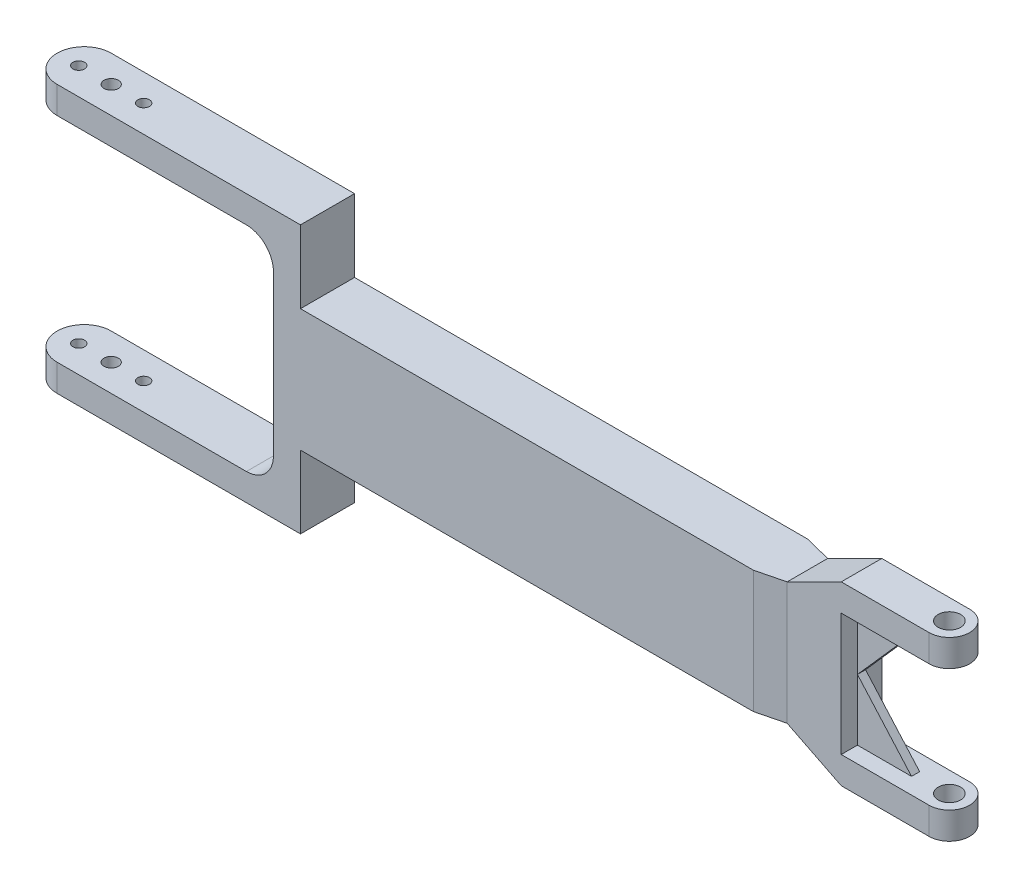
from build123d import *

# Parameters (mm, degrees)
SKETCH_2_W               = 187.5
SKETCH_2_H               = 45.3
EXTRUDE_1_DEPTH          = 10
EXTRUDE_2_DEPTH          = 7.5
CHAMFER_1_SIZE           = 20
CHAMFER_1_SIZE_2         = 5
CHAMFER_2_SIZE           = 5
CHAMFER_2_SIZE_2         = 20
SKETCH_7_W               = 40
SKETCH_7_H               = 10
EXTRUDE_6_DEPTH          = 15
SKETCH_7_3_W             = 40
SKETCH_7_3_H             = 10
CUT_EXTRUDE_3_DEPTH      = 15
EXTRUDE_7_DEPTH          = 1.5
CUT_EXTRUDE_1_DEPTH      = 314.699298692
CUT_EXTRUDE_2_DEPTH      = 307.287238552
CUT_EXTRUDE_2_DEPTH_BACK = 307.287238552
FILLET_1_R               = 10


with BuildPart() as part:
    # 草图2 → 凸台-拉伸1 (new, symmetric)
    with BuildSketch(Plane.XY):
        with Locations((-103.75, 0)):
            Rectangle(SKETCH_2_W, SKETCH_2_H)
        Polygon((-297.5, 49.5), (-297.5, 39.5), (-207.5, 39.5), (-207.5, -39.5), (-297.5, -39.5), (-297.5, -49.5), (-197.5, -49.5), (-197.5, 49.5), align=None)
    extrude(amount=EXTRUDE_1_DEPTH, both=True)

    # 草图2<3> → 凸台-拉伸2 (add, symmetric)
    with BuildSketch(Plane.XY):
        Polygon((40, -22.65), (40, -12.65), (0, -12.65), (0, 12.65), (40, 12.65), (40, 22.65), (-10, 22.65), (-10, -22.65), align=None)
    extrude(amount=EXTRUDE_2_DEPTH, both=True)

    # 倒角1
    # the kernel refuses this chamfer: 20, 5 mm, written as the material it takes off along each edge
    with BuildSketch(Plane(origin=(-10, -74.592549995, 10), x_dir=(-0.9999563942249224, 0, 0.00933861064031752), z_dir=(0, 1, 0))) as chamfer_1_piece_1_section:
        Polygon((CHAMFER_1_SIZE * 0.999956394225, -CHAMFER_1_SIZE * 0.00933861064032), (-CHAMFER_1_SIZE_2 * 0.00933861064032, -CHAMFER_1_SIZE_2 * 0.999956394225), (0, 0), align=None)
    chamfer_1_piece_1 = extrude(amount=149.185099991, mode=Mode.PRIVATE)
    chamfer_1_piece_1 = split(chamfer_1_piece_1, bisect_by=Plane(origin=(-18.245866107, 0, 7.5), z_dir=(0, 0, 1)), keep=Keep.TOP, mode=Mode.PRIVATE)
    add(chamfer_1_piece_1, mode=Mode.SUBTRACT)

    # 倒角2
    # the kernel refuses this chamfer: 20, 5 mm, written as the material it takes off along each edge
    with BuildSketch(Plane(origin=(-10, -74.592549995, -10), x_dir=(0.14778356633657133, 0, 0.9890197255468893), z_dir=(0, 1, 0))) as chamfer_2_piece_1_section:
        Polygon((CHAMFER_2_SIZE * 0.989019725547, -CHAMFER_2_SIZE * 0.147783566337), (-CHAMFER_2_SIZE_2 * 0.147783566337, -CHAMFER_2_SIZE_2 * 0.989019725547), (0, 0), align=None)
    chamfer_2_piece_1 = extrude(amount=149.185099991, mode=Mode.PRIVATE)
    chamfer_2_piece_1 = split(chamfer_2_piece_1, bisect_by=Plane(origin=(-18.245866107, 0, -7.5), z_dir=(0, 0, -1)), keep=Keep.TOP, mode=Mode.PRIVATE)
    add(chamfer_2_piece_1, mode=Mode.SUBTRACT)

    # 草图7 → 凸台-拉伸6 (add)
    with BuildSketch(Plane.XY.offset(7.5)):
        Polygon((0, 22.65), (0, 32.65), (-20, 22.65), align=None)
        with Locations((20, 27.65)):
            Rectangle(SKETCH_7_W, SKETCH_7_H)
        Polygon((40, -32.65), (0, -32.65), (-20, -22.65), (40, -22.65), align=None)
    extrude(amount=-EXTRUDE_6_DEPTH)

    # 草图7<3> → 切除-拉伸3 (cut)
    with BuildSketch(Plane.XY.offset(7.5)):
        with Locations((20, 17.65)):
            Rectangle(SKETCH_7_3_W, SKETCH_7_3_H)
        with Locations((20, -17.65)):
            Rectangle(SKETCH_7_3_W, SKETCH_7_3_H)
    extrude(amount=-CUT_EXTRUDE_3_DEPTH, mode=Mode.SUBTRACT)

    # 草图8 → 凸台-拉伸7 (add, symmetric)
    with BuildSketch(Plane.XY):
        Polygon((0, 22.65), (0, 0), (20, 22.65), align=None)
        Polygon((20, -22.65), (0, 0), (0, -22.65), align=None)
    extrude(amount=EXTRUDE_7_DEPTH, both=True)

    # 草图3 → 切除-拉伸1 (cut, through all)
    with BuildSketch(Plane(origin=(0, 49.5, 0), x_dir=(1, 0, 0), z_dir=(0, 1, 0))):
        with BuildLine():
            ThreePointArc((-297.5, 0), (-294.571067812, 7.071067812), (-287.5, 10))
            Line((-287.5, 10), (-297.5, 10))
            Line((-297.5, 10), (-297.5, 0))
        make_face()
        with BuildLine():
            Line((-297.5, -10), (-287.5, -10))
            ThreePointArc((-287.5, -10), (-294.571067812, -7.071067812), (-297.5, 0))
            Line((-297.5, 0), (-297.5, -10))
        make_face()
        with BuildLine():
            ThreePointArc((-291.65, 0), (-289.5, -2.15), (-287.35, 0))
            Line((-287.35, 0), (-291.65, 0))
        make_face()
        with BuildLine():
            Line((-291.65, 0), (-287.35, 0))
            ThreePointArc((-287.35, 0), (-289.5, 2.15), (-291.65, 0))
        make_face()
        with BuildLine():
            ThreePointArc((-280.15, 0), (-277.5, -2.65), (-274.85, 0))
            Line((-274.85, 0), (-280.15, 0))
        make_face()
        with BuildLine():
            Line((-280.15, 0), (-274.85, 0))
            ThreePointArc((-274.85, 0), (-277.5, 2.65), (-280.15, 0))
        make_face()
        with BuildLine():
            ThreePointArc((-267.65, 0), (-265.5, -2.15), (-263.35, 0))
            Line((-263.35, 0), (-267.65, 0))
        make_face()
        with BuildLine():
            Line((-267.65, 0), (-263.35, 0))
            ThreePointArc((-263.35, 0), (-265.5, 2.15), (-267.65, 0))
        make_face()
    extrude(amount=-CUT_EXTRUDE_1_DEPTH, mode=Mode.SUBTRACT)

    # 草图4 → 切除-拉伸2 (cut, two sides: drawn at the far end of the back side and taken through both)
    with BuildSketch(Plane(origin=(0, 22.65, 0), x_dir=(1, 0, 0), z_dir=(0, 1, 0)).offset(-CUT_EXTRUDE_2_DEPTH_BACK)):
        with BuildLine():
            Line((28.35, 0), (36.65, 0))
            ThreePointArc((36.65, 0), (32.5, 4.15), (28.35, 0))
        make_face()
        with BuildLine():
            ThreePointArc((28.35, 0), (32.5, -4.15), (36.65, 0))
            Line((36.65, 0), (28.35, 0))
        make_face()
        with BuildLine():
            ThreePointArc((32.5, 7.5), (37.803300859, 5.303300859), (40, 0))
            Line((40, 0), (40, 7.5))
            Line((40, 7.5), (32.5, 7.5))
        make_face()
        with BuildLine():
            Line((40, -7.5), (40, 0))
            ThreePointArc((40, 0), (37.803300859, -5.303300859), (32.5, -7.5))
            Line((32.5, -7.5), (40, -7.5))
        make_face()
    extrude(amount=CUT_EXTRUDE_2_DEPTH + CUT_EXTRUDE_2_DEPTH_BACK, mode=Mode.SUBTRACT)

    # 圆角1
    fillet_1_edges = [part.edges().sort_by_distance(p)[0] for p in [
        (-207.5, -39.5, 0),
        (-207.5, 39.5, 0),
    ]]
    fillet(fillet_1_edges, radius=FILLET_1_R)


solid = part.part
